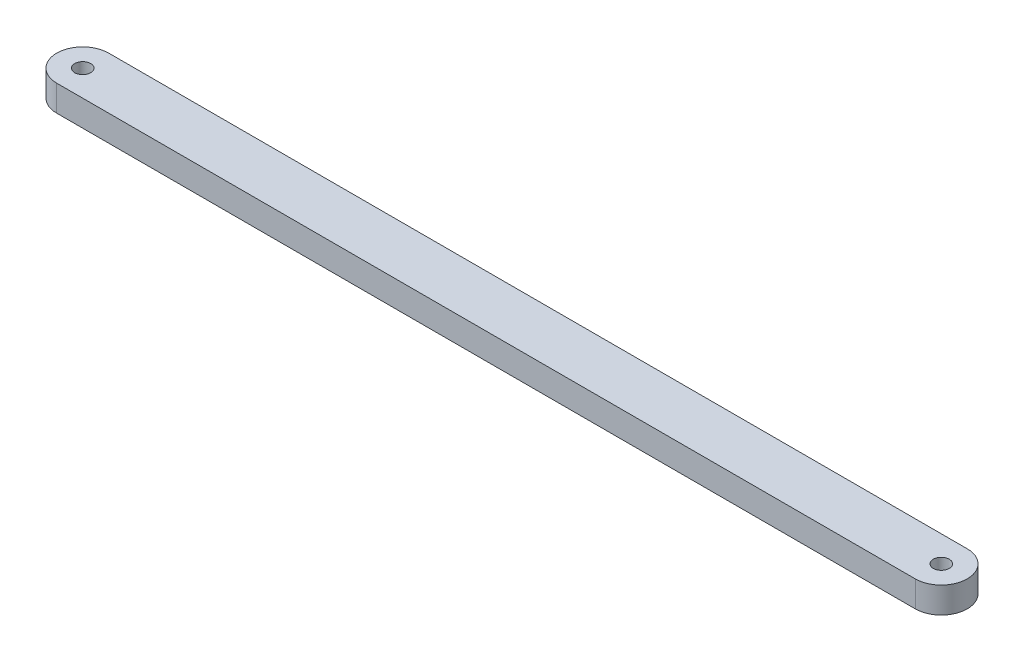
from build123d import *

# Parameters (mm, degrees)
SKETCH1_R           = 3.075
BOSS_EXTRUDE1_DEPTH = 10


with BuildPart() as part:
    # Sketch1 → Boss-Extrude1 (new body)
    with BuildSketch(Plane(origin=(0, 0, 0), x_dir=(1, 0, 0), z_dir=(0, 1, 0))):
        with BuildLine():
            Line((-165, 10), (165, 10))
            ThreePointArc((165, 10), (175, 0), (165, -10))
            Line((165, -10), (-165, -10))
            ThreePointArc((-165, -10), (-175, 0), (-165, 10))
        make_face()
        with Locations((-165, 0)):
            Circle(SKETCH1_R, mode=Mode.SUBTRACT)
        with Locations((165, 0)):
            Circle(SKETCH1_R, mode=Mode.SUBTRACT)
    extrude(amount=BOSS_EXTRUDE1_DEPTH)


solid = part.part
